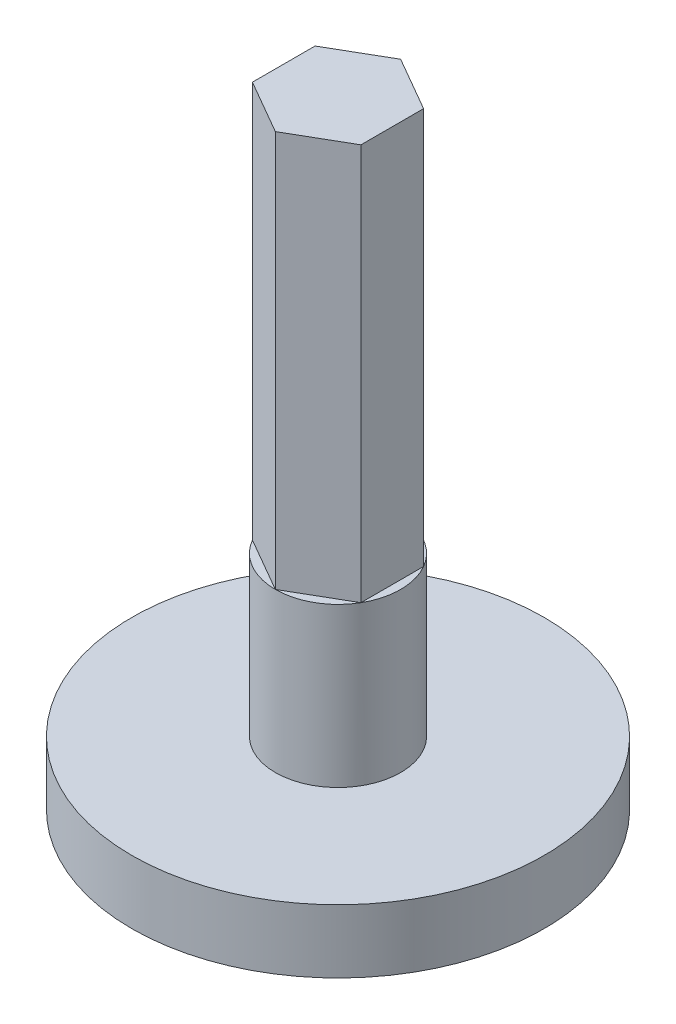
from build123d import *

# Parameters (mm, degrees)
CROQUIS3_R              = 13
SALIENTE_EXTRUIR1_DEPTH = 4
CROQUIS4_R              = 3.95
SALIENTE_EXTRUIR2_DEPTH = 35
CROQUIS12_OUTSIDE_W     = 38.72
CROQUIS12_OUTSIDE_H     = 38.72
CORTAR_EXTRUIR7_DEPTH   = 25


with BuildPart() as part:
    # Croquis3 → Saliente-Extruir1 (new body)
    with BuildSketch(Plane(origin=(0, 0, 0), x_dir=(1, 0, 0), z_dir=(0, 1, 0))):
        Circle(CROQUIS3_R)
    extrude(amount=SALIENTE_EXTRUIR1_DEPTH)

    # Croquis4 → Saliente-Extruir2 (add)
    with BuildSketch(Plane(origin=(0, 4, 0), x_dir=(1, 0, 0), z_dir=(0, 1, 0))):
        Circle(CROQUIS4_R)
    extrude(amount=SALIENTE_EXTRUIR2_DEPTH)

    # Croquis12 outside → Cortar-Extruir7 (cut)
    with BuildSketch(Plane(origin=(0, 39, 0), x_dir=(1, 0, 0), z_dir=(0, 1, 0))):
        Rectangle(CROQUIS12_OUTSIDE_W, CROQUIS12_OUTSIDE_H)
        Polygon((0, 3.95), (-3.420800345, 1.975), (-3.420800345, -1.975), (0, -3.95), (3.420800345, -1.975), (3.420800345, 1.975), align=None, mode=Mode.SUBTRACT)
    extrude(amount=-CORTAR_EXTRUIR7_DEPTH, mode=Mode.SUBTRACT)


solid = part.part
